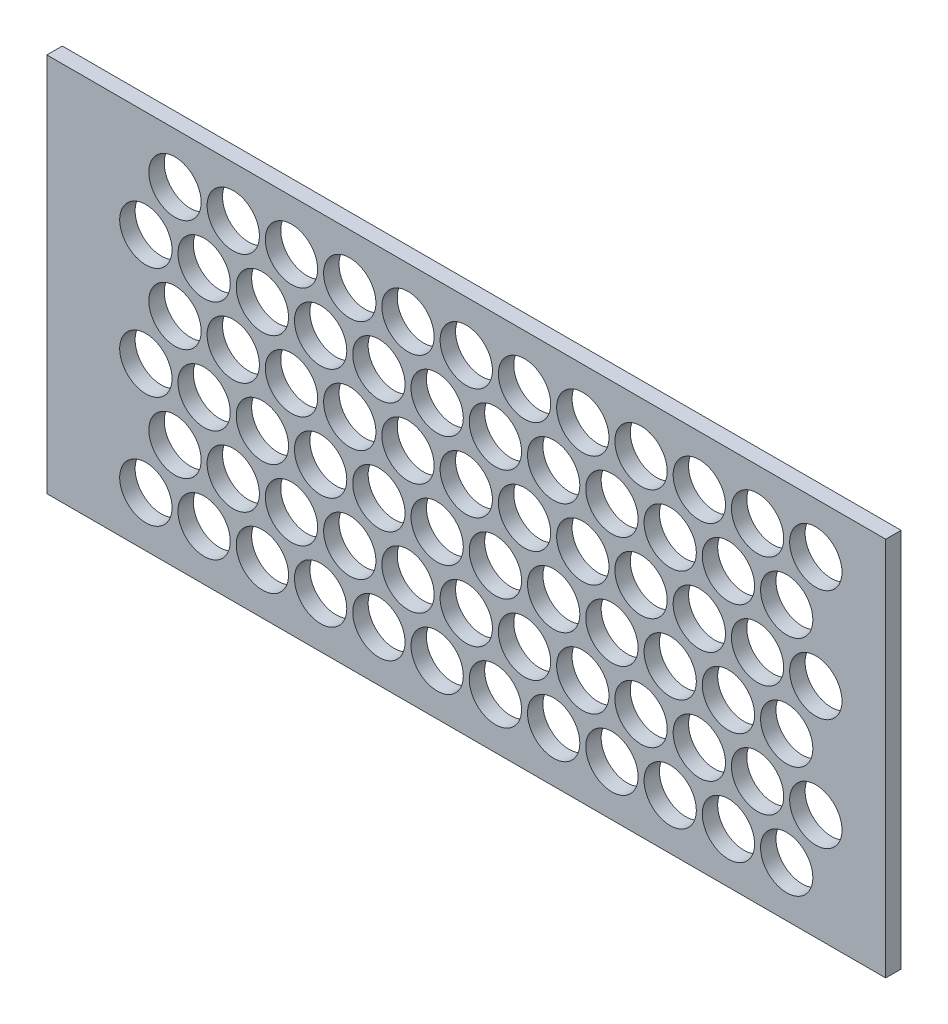
from build123d import *

# Parameters (mm, degrees)
SKETCH1_W                  = 345.57
SKETCH1_H                  = 156.55
BOSS_EXTRUDE1_DEPTH        = 6.35
SKETCH2_R                  = 10.775
CUT_EXTRUDE1_DEPTH         = 6.35
LPATTERN1_COUNT            = 12
LPATTERN1_PITCH            = 24
LPATTERN2_COPY_1_SKETCH_R  = 10.775
LPATTERN2_COPY_1_DEPTH     = 6.35
LPATTERN2_COPY_2_SKETCH_R  = 10.775
LPATTERN2_COPY_2_DEPTH     = 6.35
LPATTERN2_COPY_3_SKETCH_R  = 10.775
LPATTERN2_COPY_3_DEPTH     = 6.35
LPATTERN2_COPY_4_SKETCH_R  = 10.775
LPATTERN2_COPY_4_DEPTH     = 6.35
LPATTERN2_COPY_5_SKETCH_R  = 10.775
LPATTERN2_COPY_5_DEPTH     = 6.35
LPATTERN2_COPY_6_SKETCH_R  = 10.775
LPATTERN2_COPY_6_DEPTH     = 6.35
LPATTERN2_COPY_7_SKETCH_R  = 10.775
LPATTERN2_COPY_7_DEPTH     = 6.35
LPATTERN2_COPY_8_SKETCH_R  = 10.775
LPATTERN2_COPY_8_DEPTH     = 6.35
LPATTERN2_COPY_9_SKETCH_R  = 10.775
LPATTERN2_COPY_9_DEPTH     = 6.35
LPATTERN2_COPY_10_SKETCH_R = 10.775
LPATTERN2_COPY_10_DEPTH    = 6.35
LPATTERN2_COPY_11_SKETCH_R = 10.775
LPATTERN2_COPY_11_DEPTH    = 6.35
LPATTERN2_COPY_12_SKETCH_R = 10.775
LPATTERN2_COPY_12_DEPTH    = 6.35
LPATTERN2_COPY_13_SKETCH_R = 10.775
LPATTERN2_COPY_13_DEPTH    = 6.35
LPATTERN2_COPY_14_SKETCH_R = 10.775
LPATTERN2_COPY_14_DEPTH    = 6.35
LPATTERN2_COPY_15_SKETCH_R = 10.775
LPATTERN2_COPY_15_DEPTH    = 6.35
LPATTERN2_COPY_16_SKETCH_R = 10.775
LPATTERN2_COPY_16_DEPTH    = 6.35
LPATTERN2_COPY_17_SKETCH_R = 10.775
LPATTERN2_COPY_17_DEPTH    = 6.35
LPATTERN2_COPY_18_SKETCH_R = 10.775
LPATTERN2_COPY_18_DEPTH    = 6.35
LPATTERN2_COPY_19_SKETCH_R = 10.775
LPATTERN2_COPY_19_DEPTH    = 6.35
LPATTERN2_COPY_20_SKETCH_R = 10.775
LPATTERN2_COPY_20_DEPTH    = 6.35
LPATTERN2_COPY_21_SKETCH_R = 10.775
LPATTERN2_COPY_21_DEPTH    = 6.35
LPATTERN2_COPY_22_SKETCH_R = 10.775
LPATTERN2_COPY_22_DEPTH    = 6.35
LPATTERN2_COPY_23_SKETCH_R = 10.775
LPATTERN2_COPY_23_DEPTH    = 6.35
LPATTERN2_COPY_24_SKETCH_R = 10.775
LPATTERN2_COPY_24_DEPTH    = 6.35


with BuildPart() as part:
    # Sketch1 → Boss-Extrude1 (new body)
    with BuildSketch(Plane.XY):
        with Locations((172.785, 88.936873691)):
            Rectangle(SKETCH1_W, SKETCH1_H)
    extrude(amount=BOSS_EXTRUDE1_DEPTH)

    # Sketch2 → Cut-Extrude1 (cut)
    with BuildSketch(Plane.XY.offset(6.35)):
        with Locations((40.77523188, 31.436873691)):
            Circle(SKETCH2_R)
        with Locations((52.77523188, 54.436873691)):
            Circle(SKETCH2_R)
    cut_extrude1 = extrude(amount=-CUT_EXTRUDE1_DEPTH, mode=Mode.SUBTRACT)

    # LPattern1: Cut-Extrude1 ×12
    with Locations(*[(i * LPATTERN1_PITCH, 0, 0) for i in range(1, LPATTERN1_COUNT)]):
        add(cut_extrude1, mode=Mode.SUBTRACT)

    # LPattern2 copy 1 sketch → LPattern2 copy 1 (cut)
    with BuildSketch(Plane(origin=(24, 46, 6.35), x_dir=(1, 0, 0), z_dir=(0, 0, 1))):
        with Locations((40.77523188, 31.436873691)):
            Circle(LPATTERN2_COPY_1_SKETCH_R)
        with Locations((52.77523188, 54.436873691)):
            Circle(LPATTERN2_COPY_1_SKETCH_R)
    extrude(amount=-LPATTERN2_COPY_1_DEPTH, mode=Mode.SUBTRACT)

    # LPattern2 copy 2 sketch → LPattern2 copy 2 (cut)
    with BuildSketch(Plane(origin=(24, 92, 6.35), x_dir=(1, 0, 0), z_dir=(0, 0, 1))):
        with Locations((40.77523188, 31.436873691)):
            Circle(LPATTERN2_COPY_2_SKETCH_R)
        with Locations((52.77523188, 54.436873691)):
            Circle(LPATTERN2_COPY_2_SKETCH_R)
    extrude(amount=-LPATTERN2_COPY_2_DEPTH, mode=Mode.SUBTRACT)

    # LPattern2 copy 3 sketch → LPattern2 copy 3 (cut)
    with BuildSketch(Plane(origin=(48, 46, 6.35), x_dir=(1, 0, 0), z_dir=(0, 0, 1))):
        with Locations((40.77523188, 31.436873691)):
            Circle(LPATTERN2_COPY_3_SKETCH_R)
        with Locations((52.77523188, 54.436873691)):
            Circle(LPATTERN2_COPY_3_SKETCH_R)
    extrude(amount=-LPATTERN2_COPY_3_DEPTH, mode=Mode.SUBTRACT)

    # LPattern2 copy 4 sketch → LPattern2 copy 4 (cut)
    with BuildSketch(Plane(origin=(48, 92, 6.35), x_dir=(1, 0, 0), z_dir=(0, 0, 1))):
        with Locations((40.77523188, 31.436873691)):
            Circle(LPATTERN2_COPY_4_SKETCH_R)
        with Locations((52.77523188, 54.436873691)):
            Circle(LPATTERN2_COPY_4_SKETCH_R)
    extrude(amount=-LPATTERN2_COPY_4_DEPTH, mode=Mode.SUBTRACT)

    # LPattern2 copy 5 sketch → LPattern2 copy 5 (cut)
    with BuildSketch(Plane(origin=(72, 46, 6.35), x_dir=(1, 0, 0), z_dir=(0, 0, 1))):
        with Locations((40.77523188, 31.436873691)):
            Circle(LPATTERN2_COPY_5_SKETCH_R)
        with Locations((52.77523188, 54.436873691)):
            Circle(LPATTERN2_COPY_5_SKETCH_R)
    extrude(amount=-LPATTERN2_COPY_5_DEPTH, mode=Mode.SUBTRACT)

    # LPattern2 copy 6 sketch → LPattern2 copy 6 (cut)
    with BuildSketch(Plane(origin=(72, 92, 6.35), x_dir=(1, 0, 0), z_dir=(0, 0, 1))):
        with Locations((40.77523188, 31.436873691)):
            Circle(LPATTERN2_COPY_6_SKETCH_R)
        with Locations((52.77523188, 54.436873691)):
            Circle(LPATTERN2_COPY_6_SKETCH_R)
    extrude(amount=-LPATTERN2_COPY_6_DEPTH, mode=Mode.SUBTRACT)

    # LPattern2 copy 7 sketch → LPattern2 copy 7 (cut)
    with BuildSketch(Plane(origin=(96, 46, 6.35), x_dir=(1, 0, 0), z_dir=(0, 0, 1))):
        with Locations((40.77523188, 31.436873691)):
            Circle(LPATTERN2_COPY_7_SKETCH_R)
        with Locations((52.77523188, 54.436873691)):
            Circle(LPATTERN2_COPY_7_SKETCH_R)
    extrude(amount=-LPATTERN2_COPY_7_DEPTH, mode=Mode.SUBTRACT)

    # LPattern2 copy 8 sketch → LPattern2 copy 8 (cut)
    with BuildSketch(Plane(origin=(96, 92, 6.35), x_dir=(1, 0, 0), z_dir=(0, 0, 1))):
        with Locations((40.77523188, 31.436873691)):
            Circle(LPATTERN2_COPY_8_SKETCH_R)
        with Locations((52.77523188, 54.436873691)):
            Circle(LPATTERN2_COPY_8_SKETCH_R)
    extrude(amount=-LPATTERN2_COPY_8_DEPTH, mode=Mode.SUBTRACT)

    # LPattern2 copy 9 sketch → LPattern2 copy 9 (cut)
    with BuildSketch(Plane(origin=(120, 46, 6.35), x_dir=(1, 0, 0), z_dir=(0, 0, 1))):
        with Locations((40.77523188, 31.436873691)):
            Circle(LPATTERN2_COPY_9_SKETCH_R)
        with Locations((52.77523188, 54.436873691)):
            Circle(LPATTERN2_COPY_9_SKETCH_R)
    extrude(amount=-LPATTERN2_COPY_9_DEPTH, mode=Mode.SUBTRACT)

    # LPattern2 copy 10 sketch → LPattern2 copy 10 (cut)
    with BuildSketch(Plane(origin=(120, 92, 6.35), x_dir=(1, 0, 0), z_dir=(0, 0, 1))):
        with Locations((40.77523188, 31.436873691)):
            Circle(LPATTERN2_COPY_10_SKETCH_R)
        with Locations((52.77523188, 54.436873691)):
            Circle(LPATTERN2_COPY_10_SKETCH_R)
    extrude(amount=-LPATTERN2_COPY_10_DEPTH, mode=Mode.SUBTRACT)

    # LPattern2 copy 11 sketch → LPattern2 copy 11 (cut)
    with BuildSketch(Plane(origin=(144, 46, 6.35), x_dir=(1, 0, 0), z_dir=(0, 0, 1))):
        with Locations((40.77523188, 31.436873691)):
            Circle(LPATTERN2_COPY_11_SKETCH_R)
        with Locations((52.77523188, 54.436873691)):
            Circle(LPATTERN2_COPY_11_SKETCH_R)
    extrude(amount=-LPATTERN2_COPY_11_DEPTH, mode=Mode.SUBTRACT)

    # LPattern2 copy 12 sketch → LPattern2 copy 12 (cut)
    with BuildSketch(Plane(origin=(144, 92, 6.35), x_dir=(1, 0, 0), z_dir=(0, 0, 1))):
        with Locations((40.77523188, 31.436873691)):
            Circle(LPATTERN2_COPY_12_SKETCH_R)
        with Locations((52.77523188, 54.436873691)):
            Circle(LPATTERN2_COPY_12_SKETCH_R)
    extrude(amount=-LPATTERN2_COPY_12_DEPTH, mode=Mode.SUBTRACT)

    # LPattern2 copy 13 sketch → LPattern2 copy 13 (cut)
    with BuildSketch(Plane(origin=(168, 46, 6.35), x_dir=(1, 0, 0), z_dir=(0, 0, 1))):
        with Locations((40.77523188, 31.436873691)):
            Circle(LPATTERN2_COPY_13_SKETCH_R)
        with Locations((52.77523188, 54.436873691)):
            Circle(LPATTERN2_COPY_13_SKETCH_R)
    extrude(amount=-LPATTERN2_COPY_13_DEPTH, mode=Mode.SUBTRACT)

    # LPattern2 copy 14 sketch → LPattern2 copy 14 (cut)
    with BuildSketch(Plane(origin=(168, 92, 6.35), x_dir=(1, 0, 0), z_dir=(0, 0, 1))):
        with Locations((40.77523188, 31.436873691)):
            Circle(LPATTERN2_COPY_14_SKETCH_R)
        with Locations((52.77523188, 54.436873691)):
            Circle(LPATTERN2_COPY_14_SKETCH_R)
    extrude(amount=-LPATTERN2_COPY_14_DEPTH, mode=Mode.SUBTRACT)

    # LPattern2 copy 15 sketch → LPattern2 copy 15 (cut)
    with BuildSketch(Plane(origin=(192, 46, 6.35), x_dir=(1, 0, 0), z_dir=(0, 0, 1))):
        with Locations((40.77523188, 31.436873691)):
            Circle(LPATTERN2_COPY_15_SKETCH_R)
        with Locations((52.77523188, 54.436873691)):
            Circle(LPATTERN2_COPY_15_SKETCH_R)
    extrude(amount=-LPATTERN2_COPY_15_DEPTH, mode=Mode.SUBTRACT)

    # LPattern2 copy 16 sketch → LPattern2 copy 16 (cut)
    with BuildSketch(Plane(origin=(192, 92, 6.35), x_dir=(1, 0, 0), z_dir=(0, 0, 1))):
        with Locations((40.77523188, 31.436873691)):
            Circle(LPATTERN2_COPY_16_SKETCH_R)
        with Locations((52.77523188, 54.436873691)):
            Circle(LPATTERN2_COPY_16_SKETCH_R)
    extrude(amount=-LPATTERN2_COPY_16_DEPTH, mode=Mode.SUBTRACT)

    # LPattern2 copy 17 sketch → LPattern2 copy 17 (cut)
    with BuildSketch(Plane(origin=(216, 46, 6.35), x_dir=(1, 0, 0), z_dir=(0, 0, 1))):
        with Locations((40.77523188, 31.436873691)):
            Circle(LPATTERN2_COPY_17_SKETCH_R)
        with Locations((52.77523188, 54.436873691)):
            Circle(LPATTERN2_COPY_17_SKETCH_R)
    extrude(amount=-LPATTERN2_COPY_17_DEPTH, mode=Mode.SUBTRACT)

    # LPattern2 copy 18 sketch → LPattern2 copy 18 (cut)
    with BuildSketch(Plane(origin=(216, 92, 6.35), x_dir=(1, 0, 0), z_dir=(0, 0, 1))):
        with Locations((40.77523188, 31.436873691)):
            Circle(LPATTERN2_COPY_18_SKETCH_R)
        with Locations((52.77523188, 54.436873691)):
            Circle(LPATTERN2_COPY_18_SKETCH_R)
    extrude(amount=-LPATTERN2_COPY_18_DEPTH, mode=Mode.SUBTRACT)

    # LPattern2 copy 19 sketch → LPattern2 copy 19 (cut)
    with BuildSketch(Plane(origin=(240, 46, 6.35), x_dir=(1, 0, 0), z_dir=(0, 0, 1))):
        with Locations((40.77523188, 31.436873691)):
            Circle(LPATTERN2_COPY_19_SKETCH_R)
        with Locations((52.77523188, 54.436873691)):
            Circle(LPATTERN2_COPY_19_SKETCH_R)
    extrude(amount=-LPATTERN2_COPY_19_DEPTH, mode=Mode.SUBTRACT)

    # LPattern2 copy 20 sketch → LPattern2 copy 20 (cut)
    with BuildSketch(Plane(origin=(240, 92, 6.35), x_dir=(1, 0, 0), z_dir=(0, 0, 1))):
        with Locations((40.77523188, 31.436873691)):
            Circle(LPATTERN2_COPY_20_SKETCH_R)
        with Locations((52.77523188, 54.436873691)):
            Circle(LPATTERN2_COPY_20_SKETCH_R)
    extrude(amount=-LPATTERN2_COPY_20_DEPTH, mode=Mode.SUBTRACT)

    # LPattern2 copy 21 sketch → LPattern2 copy 21 (cut)
    with BuildSketch(Plane(origin=(264, 46, 6.35), x_dir=(1, 0, 0), z_dir=(0, 0, 1))):
        with Locations((40.77523188, 31.436873691)):
            Circle(LPATTERN2_COPY_21_SKETCH_R)
        with Locations((52.77523188, 54.436873691)):
            Circle(LPATTERN2_COPY_21_SKETCH_R)
    extrude(amount=-LPATTERN2_COPY_21_DEPTH, mode=Mode.SUBTRACT)

    # LPattern2 copy 22 sketch → LPattern2 copy 22 (cut)
    with BuildSketch(Plane(origin=(264, 92, 6.35), x_dir=(1, 0, 0), z_dir=(0, 0, 1))):
        with Locations((40.77523188, 31.436873691)):
            Circle(LPATTERN2_COPY_22_SKETCH_R)
        with Locations((52.77523188, 54.436873691)):
            Circle(LPATTERN2_COPY_22_SKETCH_R)
    extrude(amount=-LPATTERN2_COPY_22_DEPTH, mode=Mode.SUBTRACT)

    # LPattern2 copy 23 sketch → LPattern2 copy 23 (cut)
    with BuildSketch(Plane(origin=(0, 46, 6.35), x_dir=(1, 0, 0), z_dir=(0, 0, 1))):
        with Locations((40.77523188, 31.436873691)):
            Circle(LPATTERN2_COPY_23_SKETCH_R)
        with Locations((52.77523188, 54.436873691)):
            Circle(LPATTERN2_COPY_23_SKETCH_R)
    extrude(amount=-LPATTERN2_COPY_23_DEPTH, mode=Mode.SUBTRACT)

    # LPattern2 copy 24 sketch → LPattern2 copy 24 (cut)
    with BuildSketch(Plane(origin=(0, 92, 6.35), x_dir=(1, 0, 0), z_dir=(0, 0, 1))):
        with Locations((40.77523188, 31.436873691)):
            Circle(LPATTERN2_COPY_24_SKETCH_R)
        with Locations((52.77523188, 54.436873691)):
            Circle(LPATTERN2_COPY_24_SKETCH_R)
    extrude(amount=-LPATTERN2_COPY_24_DEPTH, mode=Mode.SUBTRACT)


solid = part.part
